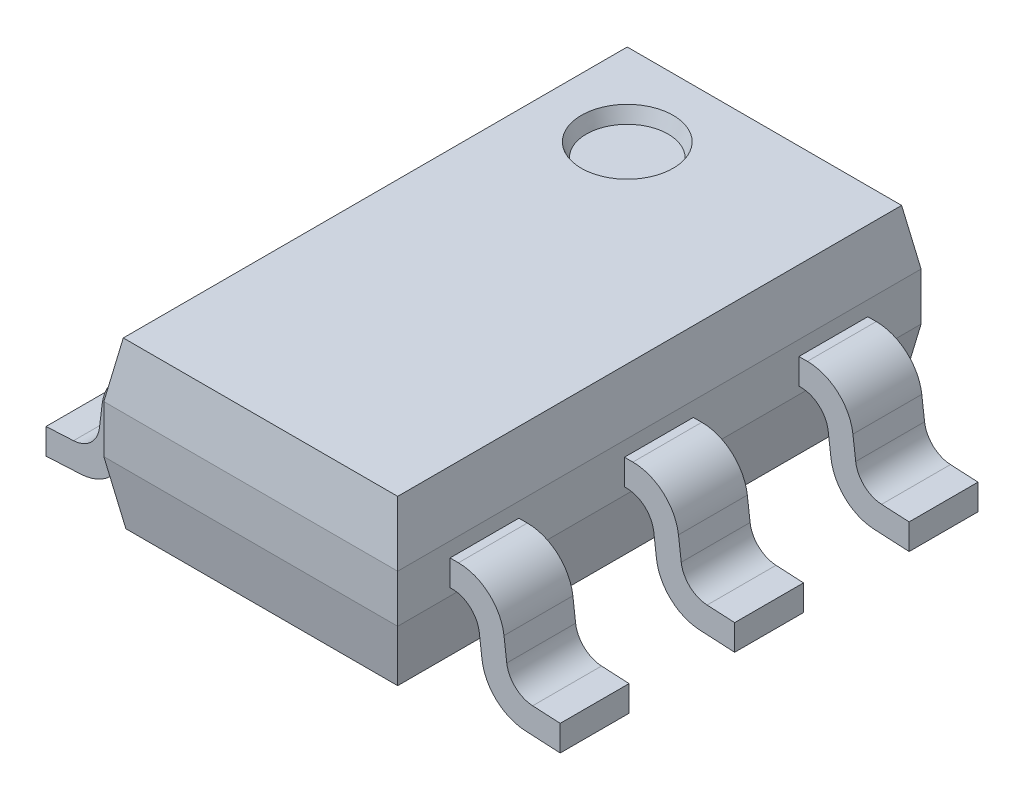
from build123d import *
from OCP.BRepFilletAPI import BRepFilletAPI_MakeChamfer

# Parameters (mm, degrees)
SKETCH1_W            = 1.6
SKETCH1_H            = 2.85
BOSS_EXTRUDE1_DEPTH  = 0.9
CHAMFER1_SIZE        = 0.06
CHAMFER1_SIZE2       = 0.340276909
CHAMFER2_SIZE        = 0.3
CHAMFER2_SIZE2       = 0.052898094
SKETCH3_R            = 0.25
MARK_PIN1_DEPTH      = 0.075
MARK_PIN1_DRAFT      = -20
PIN_EXTRUDE_DEPTH    = 0.375
FILLET1_R            = 0.15
FILLET2_R            = 0.25
FILLET1_OF_MIRROR1_R = 0.15
FILLET2_OF_MIRROR1_R = 0.25
PIN_PATTERN_START    = -0.185
PIN_PATTERN_DEPTH    = 0.375
PIN_PATTERN_START_2  = 0.765
PIN_PATTERN_2_DEPTH  = 0.375


# Read off the part's stored shape, not the designer's step: pin_pattern
with BuildPart() as part:
    # Sketch1 → Boss-Extrude1 (new body)
    with BuildSketch(Plane(origin=(0, 0.1, 0), x_dir=(1, 0, 0), z_dir=(0, 1, 0))):
        Rectangle(SKETCH1_W, SKETCH1_H)
    extrude(amount=BOSS_EXTRUDE1_DEPTH)

    # Chamfer1
    chamfer1_edges = [part.edges().sort_by_distance(p)[0] for p in [
        (0, 0.1, 1.425),
        (-0.8, 0.1, 0),
        (0, 0.1, -1.425),
        (0.8, 0.1, 0),
    ]]
    chamfer1_side = [part.faces().sort_by_distance(p)[0] for p in [
        (0, 0.1, 0),
    ]]
    chamfer(chamfer1_edges, length=CHAMFER1_SIZE, length2=CHAMFER1_SIZE2, reference=chamfer1_side[0])

    # Chamfer2: one chamfer whose edges measure the first distance from different faces: ONE call of the kernel's chamfer builder (chamfer() names one face for all edges)
    chamfer2_edges_1 = [part.edges().sort_by_distance(p)[0] for p in [
        (-0.8, 1, 0),
    ]]
    chamfer2_side_1 = [part.faces().sort_by_distance(p)[0] for p in [
        (-0.8, 0.720138455, 0),
    ]]
    chamfer2_edges_2 = [part.edges().sort_by_distance(p)[0] for p in [
        (0, 1, 1.425),
    ]]
    chamfer2_side_2 = [part.faces().sort_by_distance(p)[0] for p in [
        (0, 0.720138455, 1.425),
    ]]
    chamfer2_edges_3 = [part.edges().sort_by_distance(p)[0] for p in [
        (0.8, 1, 0),
    ]]
    chamfer2_side_3 = [part.faces().sort_by_distance(p)[0] for p in [
        (0.8, 0.720138455, 0),
    ]]
    chamfer2_edges_4 = [part.edges().sort_by_distance(p)[0] for p in [
        (0, 1, -1.425),
    ]]
    chamfer2_side_4 = [part.faces().sort_by_distance(p)[0] for p in [
        (0, 0.720138455, -1.425),
    ]]
    chamfer2 = BRepFilletAPI_MakeChamfer(part.part.solid().wrapped)
    for e in chamfer2_edges_1:
        chamfer2.Add(CHAMFER2_SIZE, CHAMFER2_SIZE2, e.wrapped, chamfer2_side_1[0].wrapped)  # the first distance lies on this face
    for e in chamfer2_edges_2:
        chamfer2.Add(CHAMFER2_SIZE, CHAMFER2_SIZE2, e.wrapped, chamfer2_side_2[0].wrapped)  # the first distance lies on this face
    for e in chamfer2_edges_3:
        chamfer2.Add(CHAMFER2_SIZE, CHAMFER2_SIZE2, e.wrapped, chamfer2_side_3[0].wrapped)  # the first distance lies on this face
    for e in chamfer2_edges_4:
        chamfer2.Add(CHAMFER2_SIZE, CHAMFER2_SIZE2, e.wrapped, chamfer2_side_4[0].wrapped)  # the first distance lies on this face
    add(Compound.cast(chamfer2.Shape()), mode=Mode.REPLACE)


with BuildPart() as mark_pin1_tool:
    # Sketch3 → mark pin1 (with draft: the straight prism first)
    with BuildSketch(Plane(origin=(0, 1, 0), x_dir=(1, 0, 0), z_dir=(0, 1, 0))):
        with Locations((-0.3, 0.925)):
            Circle(SKETCH3_R)
    extrude(amount=-MARK_PIN1_DEPTH)
    # mark pin1: the draft: its side faces are tilted about the plane it starts from
    mark_pin1_sides = [mark_pin1_tool.faces().sort_by_distance(p)[0] for p in [
        (-0.55, 0.9625, -0.925),
    ]]
    draft(mark_pin1_sides, Plane(origin=(0, 1, 0), x_dir=(1, 0, 0), z_dir=(0, 1, 0)), MARK_PIN1_DRAFT)


with BuildPart() as part_1:
    add(part.part)

    # mark pin1: cut by mark_pin1_tool
    add(mark_pin1_tool.part, mode=Mode.SUBTRACT)

    # Sketch2 → pin extrude (add)
    with BuildSketch(Plane(origin=(0, 0, -1.135), x_dir=(-1, 0, 0), z_dir=(0, 0, -1))):
        Polygon((1.4, 0), (1.4, 0.14), (1.124504771, 0.154438093), (1.066708826, 0.62), (0, 0.62), (0, 0.48), (0.943014086, 0.48), (1, 0.020963112), align=None)
    pin_extrude = extrude(amount=-PIN_EXTRUDE_DEPTH)

    # Fillet1
    fillet1_edges = [part_1.edges().sort_by_distance(p)[0] for p in [
        (-0.943014086, 0.48, -0.9475),
        (-1.124504771, 0.154438093, -0.9475),
    ]]
    fillet(fillet1_edges, radius=FILLET1_R)

    # Fillet2
    fillet2_edges = [part_1.edges().sort_by_distance(p)[0] for p in [
        (-1, 0.020963112, -0.9475),
        (-1.066708826, 0.62, -0.9475),
    ]]
    fillet(fillet2_edges, radius=FILLET2_R)

    # Mirror1: pin extrude across plane
    add(pin_extrude.mirror(Plane(origin=(0, 0, 0), x_dir=(0, 0, 1), z_dir=(1, 0, 0))))

    # Fillet1 of Mirror1
    fillet1_of_mirror1_edges = [part_1.edges().sort_by_distance(p)[0] for p in [
        (0.943014086, 0.48, -0.9475),
        (1.124504771, 0.154438093, -0.9475),
    ]]
    fillet(fillet1_of_mirror1_edges, radius=FILLET1_OF_MIRROR1_R)

    # Fillet2 of Mirror1
    fillet2_of_mirror1_edges = [part_1.edges().sort_by_distance(p)[0] for p in [
        (1, 0.020963112, -0.9475),
        (1.066708826, 0.62, -0.9475),
    ]]
    fillet(fillet2_of_mirror1_edges, radius=FILLET2_OF_MIRROR1_R)

    # pin_pattern outline → pin_pattern (add)
    with BuildSketch(Plane.XY.offset(PIN_PATTERN_START)):
        with BuildLine():
            Line((0.8, 0.48), (0.810484007, 0.48))
            ThreePointArc((0.810484007, 0.48), (0.909801869, 0.442409797), (0.959341349, 0.348479499))
            Line((0.959341349, 0.348479499), (0.974191509, 0.228857461))
            ThreePointArc((0.974191509, 0.228857461), (1.05190979, 0.076704229), (1.209203089, 0.009999242))
            Line((1.209203089, 0.009999242), (1.4, 0))
            Line((1.4, 0), (1.4, 0.14))
            Line((1.4, 0.14), (1.250026624, 0.147859772))
            ThreePointArc((1.250026624, 0.147859772), (1.155650645, 0.187882764), (1.109019676, 0.279174703))
            Line((1.109019676, 0.279174703), (1.093920931, 0.400799165))
            ThreePointArc((1.093920931, 0.400799165), (1.011355131, 0.557349661), (0.845825362, 0.62))
            Line((0.845825362, 0.62), (0.8, 0.62))
            Line((0.8, 0.62), (0.8, 0.48))
        make_face()
        with BuildLine():
            ThreePointArc((-0.959341349, 0.348479499), (-0.909801869, 0.442409797), (-0.810484007, 0.48))
            Line((-0.810484007, 0.48), (-0.8, 0.48))
            Line((-0.8, 0.48), (-0.8, 0.62))
            Line((-0.8, 0.62), (-0.845825362, 0.62))
            ThreePointArc((-0.845825362, 0.62), (-1.011355131, 0.557349661), (-1.093920931, 0.400799165))
            Line((-1.093920931, 0.400799165), (-1.109019676, 0.279174703))
            ThreePointArc((-1.109019676, 0.279174703), (-1.155650645, 0.187882764), (-1.250026624, 0.147859772))
            Line((-1.250026624, 0.147859772), (-1.4, 0.14))
            Line((-1.4, 0.14), (-1.4, 0))
            Line((-1.4, 0), (-1.209203089, 0.009999242))
            ThreePointArc((-1.209203089, 0.009999242), (-1.05190979, 0.076704229), (-0.974191509, 0.228857461))
            Line((-0.974191509, 0.228857461), (-0.959341349, 0.348479499))
        make_face()
    extrude(amount=PIN_PATTERN_DEPTH)

    # pin_pattern 2 outline → pin_pattern 2 (add)
    with BuildSketch(Plane.XY.offset(PIN_PATTERN_START_2)):
        with BuildLine():
            Line((0.8, 0.48), (0.810484007, 0.48))
            ThreePointArc((0.810484007, 0.48), (0.909801869, 0.442409797), (0.959341349, 0.348479499))
            Line((0.959341349, 0.348479499), (0.974191509, 0.228857461))
            ThreePointArc((0.974191509, 0.228857461), (1.05190979, 0.076704229), (1.209203089, 0.009999242))
            Line((1.209203089, 0.009999242), (1.4, 0))
            Line((1.4, 0), (1.4, 0.14))
            Line((1.4, 0.14), (1.250026624, 0.147859772))
            ThreePointArc((1.250026624, 0.147859772), (1.155650645, 0.187882764), (1.109019676, 0.279174703))
            Line((1.109019676, 0.279174703), (1.093920931, 0.400799165))
            ThreePointArc((1.093920931, 0.400799165), (1.011355131, 0.557349661), (0.845825362, 0.62))
            Line((0.845825362, 0.62), (0.8, 0.62))
            Line((0.8, 0.62), (0.8, 0.48))
        make_face()
        with BuildLine():
            ThreePointArc((-0.959341349, 0.348479499), (-0.909801869, 0.442409797), (-0.810484007, 0.48))
            Line((-0.810484007, 0.48), (-0.8, 0.48))
            Line((-0.8, 0.48), (-0.8, 0.62))
            Line((-0.8, 0.62), (-0.845825362, 0.62))
            ThreePointArc((-0.845825362, 0.62), (-1.011355131, 0.557349661), (-1.093920931, 0.400799165))
            Line((-1.093920931, 0.400799165), (-1.109019676, 0.279174703))
            ThreePointArc((-1.109019676, 0.279174703), (-1.155650645, 0.187882764), (-1.250026624, 0.147859772))
            Line((-1.250026624, 0.147859772), (-1.4, 0.14))
            Line((-1.4, 0.14), (-1.4, 0))
            Line((-1.4, 0), (-1.209203089, 0.009999242))
            ThreePointArc((-1.209203089, 0.009999242), (-1.05190979, 0.076704229), (-0.974191509, 0.228857461))
            Line((-0.974191509, 0.228857461), (-0.959341349, 0.348479499))
        make_face()
    extrude(amount=PIN_PATTERN_2_DEPTH)


solid = part_1.part
